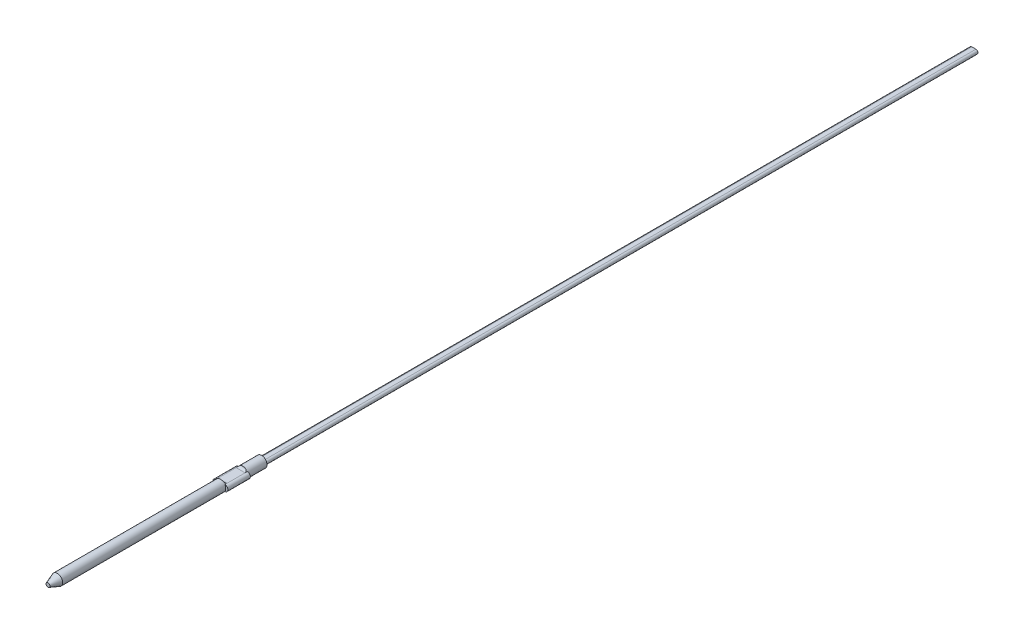
from build123d import *

# Parameters (mm, degrees)
SKETCH1_R           = 1.8161
BOSS_EXTRUDE1_DEPTH = 38.1
CHAMFER1_SIZE       = 3.175
CHAMFER1_SIZE2      = 1.155605494
BOSS_EXTRUDE2_START = 2.54
SKETCH2_R           = 1.8161
BOSS_EXTRUDE2_DEPTH = 2.54
BOSS_EXTRUDE3_START = 17.78
SKETCH3_R           = 1.8161
BOSS_EXTRUDE3_DEPTH = 17.78
BOSS_EXTRUDE4_DEPTH = 7.62
BOSS_EXTRUDE5_START = 6.35
BOSS_EXTRUDE5_DEPTH = 6.35
BOSS_EXTRUDE6_DEPTH = 241.3
FILLET2_R           = 0.762


with BuildPart() as part:
    # Sketch1 → Boss-Extrude1 (new body)
    with BuildSketch(Plane.XY):
        with Locations(Location((0, 0, 0), (0, 0, 180))):
            Circle(SKETCH1_R)
    extrude(amount=BOSS_EXTRUDE1_DEPTH)

    # Chamfer1
    chamfer1_edges = [part.edges().sort_by_distance(p)[0] for p in [
        (1.8161, 0, 38.1),
    ]]
    chamfer1_side = [part.faces().sort_by_distance(p)[0] for p in [
        (1.8161, 0, 19.05),
    ]]
    chamfer(chamfer1_edges, length=CHAMFER1_SIZE, length2=CHAMFER1_SIZE2, reference=chamfer1_side[0])

    # Sketch2 → Boss-Extrude2 (add)
    with BuildSketch(Plane(origin=(0, 0, 0), x_dir=(-1, 0, 0), z_dir=(0, 0, -1)).offset(BOSS_EXTRUDE2_START)):
        Circle(SKETCH2_R)
    extrude(amount=-BOSS_EXTRUDE2_DEPTH)

    # Sketch3 → Boss-Extrude3 (add)
    with BuildSketch(Plane(origin=(0, 0, -2.54), x_dir=(-1, 0, 0), z_dir=(0, 0, -1)).offset(BOSS_EXTRUDE3_START)):
        Circle(SKETCH3_R)
    extrude(amount=-BOSS_EXTRUDE3_DEPTH)

    # Sketch4 → Boss-Extrude4 (add)
    with BuildSketch(Plane(origin=(0, 0, -20.32), x_dir=(-1, 0, 0), z_dir=(0, 0, -1))):
        with BuildLine():
            Line((-1.524, 1.016), (1.524, 1.016))
            ThreePointArc((1.524, 1.016), (2.54, 0), (1.524, -1.016))
            Line((1.524, -1.016), (-1.524, -1.016))
            ThreePointArc((-1.524, -1.016), (-2.54, 0), (-1.524, 1.016))
        make_face()
    extrude(amount=BOSS_EXTRUDE4_DEPTH)

    # Sketch5 → Boss-Extrude5 (add)
    with BuildSketch(Plane(origin=(0, 0, -27.94), x_dir=(-1, 0, 0), z_dir=(0, 0, -1)).offset(BOSS_EXTRUDE5_START)):
        with BuildLine():
            ThreePointArc((-1.50542625, -1.01583021), (0, -1.8161), (1.50542625, -1.01583021))
            ThreePointArc((1.50542625, -1.01583021), (0, 1.8161), (-1.50542625, -1.01583021))
        make_face()
    extrude(amount=-BOSS_EXTRUDE5_DEPTH)

    # Sketch6 → Boss-Extrude6 (add)
    with BuildSketch(Plane(origin=(0, 0, -34.29), x_dir=(-1, 0, 0), z_dir=(0, 0, -1))):
        with BuildLine():
            Line((0.6985, -0.6985), (-0.6985, -0.6985))
            ThreePointArc((-0.6985, -0.6985), (-1.397, 0), (-0.6985, 0.6985))
            Line((-0.6985, 0.6985), (0.6985, 0.6985))
            ThreePointArc((0.6985, 0.6985), (1.397, 0), (0.6985, -0.6985))
        make_face()
    extrude(amount=BOSS_EXTRUDE6_DEPTH)

    # Fillet2
    # the kernel refuses this fillet: 0.762 mm, written as the material it adds along each edge
    with BuildSketch(Plane(origin=(-3.410311665, -1.016, -20.32), x_dir=(0, -1, 0), z_dir=(1, 0, 0))) as fillet2_piece_1_section:
        with BuildLine():
            CenterArc((FILLET2_R, FILLET2_R), FILLET2_R, 180, 90)
            Line((0, FILLET2_R), (0, 0))
            Line((0, 0), (FILLET2_R, 0))
        make_face()
    fillet2_piece_1 = extrude(amount=6.820623331, mode=Mode.PRIVATE)
    fillet2_piece_1 = fillet2_piece_1 & Plane(origin=(0, 0, -20.517592364), x_dir=(-1, 0, 0), z_dir=(0, 0, -1)) * Cylinder(1.8161, 17, mode=Mode.PRIVATE)
    add(fillet2_piece_1)
    with BuildSketch(Plane(origin=(3.410311665, 1.016, -20.32), x_dir=(0, 1, 0), z_dir=(-1, 0, 0))) as fillet2_piece_2_section:
        with BuildLine():
            CenterArc((FILLET2_R, FILLET2_R), FILLET2_R, 180, 90)
            Line((0, FILLET2_R), (0, 0))
            Line((0, 0), (FILLET2_R, 0))
        make_face()
    fillet2_piece_2 = extrude(amount=6.820623331, mode=Mode.PRIVATE)
    fillet2_piece_2 = fillet2_piece_2 & Plane(origin=(0, 0, -20.517592364), x_dir=(-1, 0, 0), z_dir=(0, 0, -1)) * Cylinder(1.8161, 17, mode=Mode.PRIVATE)
    add(fillet2_piece_2)
    with BuildSketch(Plane(origin=(-3.410311665, -1.016, -27.94), x_dir=(0, 0, 1), z_dir=(1, 0, 0))) as fillet2_piece_3_section:
        with BuildLine():
            CenterArc((FILLET2_R, FILLET2_R), FILLET2_R, 180, 90)
            Line((0, FILLET2_R), (0, 0))
            Line((0, 0), (FILLET2_R, 0))
        make_face()
    fillet2_piece_3 = extrude(amount=6.820623331, mode=Mode.PRIVATE)
    fillet2_piece_3 = fillet2_piece_3 & Plane(origin=(0, 0, -27.742407671), x_dir=(0.8289335664335663, -0.5593470679638254, 0), z_dir=(0, 0, -1)) * Cylinder(1.8161, 17, mode=Mode.PRIVATE)
    add(fillet2_piece_3)
    with BuildSketch(Plane(origin=(3.410311665, 1.016, -27.94), x_dir=(0, 0, 1), z_dir=(-1, 0, 0))) as fillet2_piece_4_section:
        with BuildLine():
            CenterArc((FILLET2_R, FILLET2_R), FILLET2_R, 180, 90)
            Line((0, FILLET2_R), (0, 0))
            Line((0, 0), (FILLET2_R, 0))
        make_face()
    fillet2_piece_4 = extrude(amount=6.820623331, mode=Mode.PRIVATE)
    fillet2_piece_4 = fillet2_piece_4 & Plane(origin=(0, 0, -27.742407638), x_dir=(0.8289335664335663, -0.5593470679638254, 0), z_dir=(0, 0, -1)) * Cylinder(1.8161, 17, mode=Mode.PRIVATE)
    add(fillet2_piece_4)


solid = part.part
